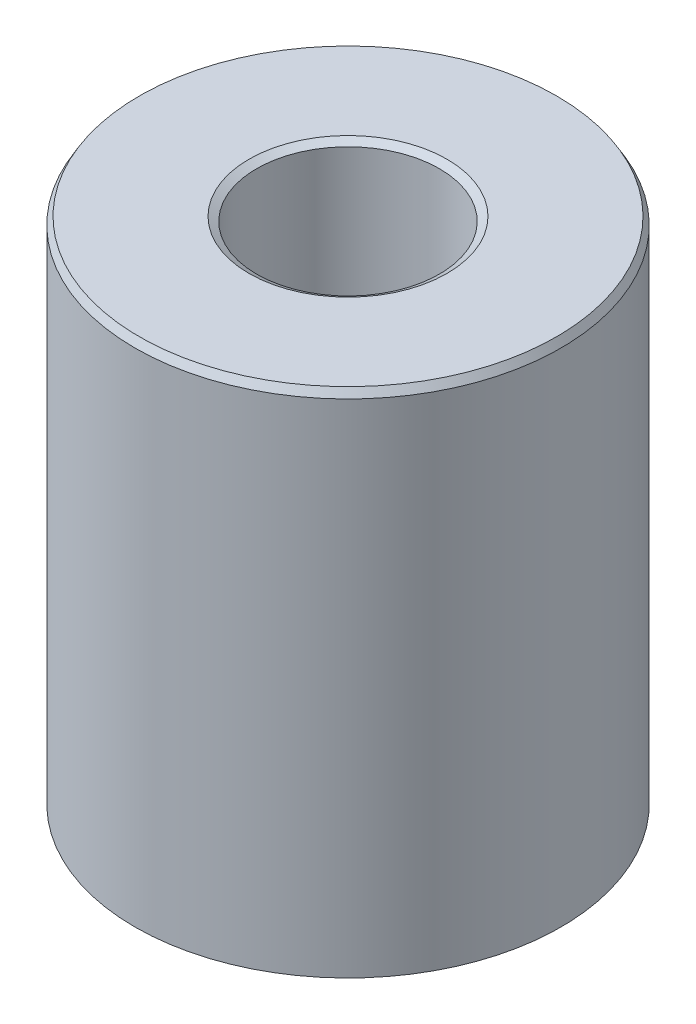
from build123d import *
from OCP.BRepFilletAPI import BRepFilletAPI_MakeChamfer

# Parameters (mm, degrees)
SKETCH1_R           = 35
BOSS_EXTRUDE1_DEPTH = 84.369009484
SKETCH2_R           = 15.019718552
CUT_EXTRUDE1_DEPTH  = 98.816817374
CHAMFER1_SIZE       = 1.247572797
CHAMFER1_SIZE2      = 0.72028649


with BuildPart() as part:
    # Sketch1 → Boss-Extrude1 (new body)
    with BuildSketch(Plane(origin=(0, 0, 0), x_dir=(1, 0, 0), z_dir=(0, 1, 0))):
        Circle(SKETCH1_R)
    extrude(amount=BOSS_EXTRUDE1_DEPTH)

    # Sketch2 → Cut-Extrude1 (cut, through all)
    with BuildSketch(Plane(origin=(0, 0, 0), x_dir=(1, 0, 0), z_dir=(0, 1, 0))):
        Circle(SKETCH2_R)
    extrude(amount=CUT_EXTRUDE1_DEPTH, mode=Mode.SUBTRACT)

    # Chamfer1: one chamfer whose edges measure the first distance from different faces: ONE call of the kernel's chamfer builder (chamfer() names one face for all edges)
    chamfer1_edges_1 = [part.edges().sort_by_distance(p)[0] for p in [
        (-15.019718552, 84.369009484, 0),
    ]]
    chamfer1_side_1 = [part.faces().sort_by_distance(p)[0] for p in [
        (-34.010050506, 84.369009484, 0),
    ]]
    chamfer1_edges_2 = [part.edges().sort_by_distance(p)[0] for p in [
        (-15.019718552, 0, 0),
    ]]
    chamfer1_side_2 = [part.faces().sort_by_distance(p)[0] for p in [
        (-15.019718552, 42.184504742, 0),
    ]]
    chamfer1_edges_3 = [part.edges().sort_by_distance(p)[0] for p in [
        (-35, 0, 0),
    ]]
    chamfer1_side_3 = [part.faces().sort_by_distance(p)[0] for p in [
        (-34.010050506, 0, 0),
    ]]
    chamfer1_edges_4 = [part.edges().sort_by_distance(p)[0] for p in [
        (-35, 84.369009484, 0),
    ]]
    chamfer1_side_4 = [part.faces().sort_by_distance(p)[0] for p in [
        (-35, 42.184504742, 0),
    ]]
    chamfer1 = BRepFilletAPI_MakeChamfer(part.part.solid().wrapped)
    for e in chamfer1_edges_1:
        chamfer1.Add(CHAMFER1_SIZE, CHAMFER1_SIZE2, e.wrapped, chamfer1_side_1[0].wrapped)  # the first distance lies on this face
    for e in chamfer1_edges_2:
        chamfer1.Add(CHAMFER1_SIZE, CHAMFER1_SIZE2, e.wrapped, chamfer1_side_2[0].wrapped)  # the first distance lies on this face
    for e in chamfer1_edges_3:
        chamfer1.Add(CHAMFER1_SIZE, CHAMFER1_SIZE2, e.wrapped, chamfer1_side_3[0].wrapped)  # the first distance lies on this face
    for e in chamfer1_edges_4:
        chamfer1.Add(CHAMFER1_SIZE, CHAMFER1_SIZE2, e.wrapped, chamfer1_side_4[0].wrapped)  # the first distance lies on this face
    add(Compound.cast(chamfer1.Shape()), mode=Mode.REPLACE)


solid = part.part
